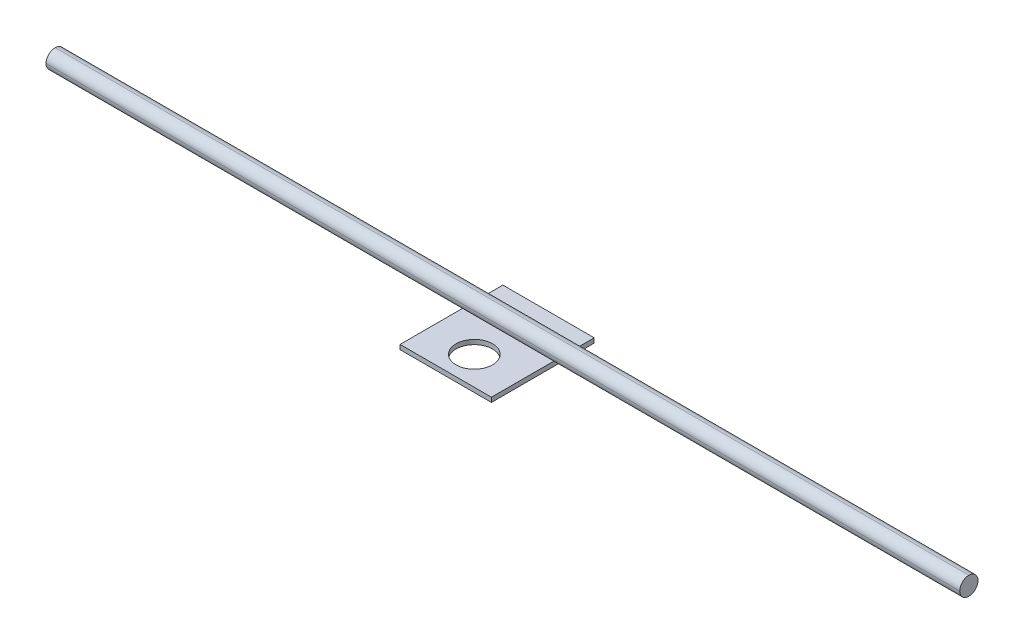
from build123d import *

# Parameters (mm, degrees)
SKETCH3_W           = 40
SKETCH3_H           = 45
BOSS_EXTRUDE1_DEPTH = 2
BOSS_EXTRUDE3_DEPTH = 8
FILLET2_R           = 4
SKETCH5_R           = 8
CUT_EXTRUDE1_DEPTH  = 202.420579882


with BuildPart() as part:
    # Sketch3 → Boss-Extrude1 (new body)
    with BuildSketch(Plane(origin=(0, 0, 0), x_dir=(1, 0, 0), z_dir=(0, 1, 0))):
        Rectangle(SKETCH3_W, SKETCH3_H)
    extrude(amount=BOSS_EXTRUDE1_DEPTH)

    # Sketch5 → Cut-Extrude1 (cut, through all)
    with BuildSketch(Plane(origin=(0, 2, 0), x_dir=(1, 0, 0), z_dir=(0, 1, 0))):
        with Locations(Location((0, -10, 0), (0, 0, 270))):
            Circle(SKETCH5_R)
    extrude(amount=-CUT_EXTRUDE1_DEPTH, mode=Mode.SUBTRACT)


with BuildPart() as body_2:
    # Sketch4 → Boss-Extrude3 (new body)
    with BuildSketch(Plane(origin=(0, 2, 0), x_dir=(1, 0, 0), z_dir=(0, 1, 0))):
        Polygon((-200, 10.5), (-200, 2.5), (0, 2.5), (200, 2.5), (200, 10.5), align=None)
    extrude(amount=BOSS_EXTRUDE3_DEPTH)

    # Fillet2
    fillet2_edges = [body_2.edges().sort_by_distance(p)[0] for p in [
        (0, 2, -10.5),
        (0, 2, -2.5),
        (0, 10, -2.5),
        (0, 10, -10.5),
    ]]
    fillet(fillet2_edges, radius=FILLET2_R - 0.0001)  # a hair under: the kernel refuses the full size


solid = Compound([part.part, body_2.part])
